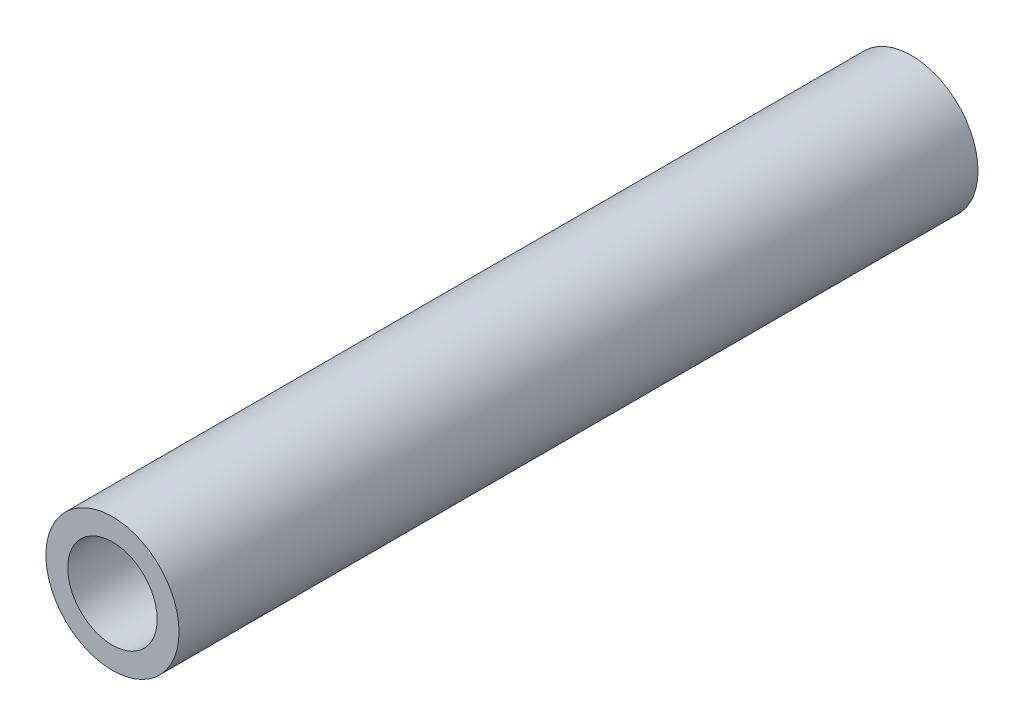
from build123d import *

# Parameters (mm, degrees)
SKETCH_1_R      = 6.25
SKETCH_1_R_2    = 4.2
EXTRUDE_1_DEPTH = 75


with BuildPart() as part:
    # Эскиз1 → Бобышка-Вытянуть1 (new body)
    with BuildSketch(Plane.XY):
        Circle(SKETCH_1_R)
        Circle(SKETCH_1_R_2, mode=Mode.SUBTRACT)
    extrude(amount=EXTRUDE_1_DEPTH)


solid = part.part
